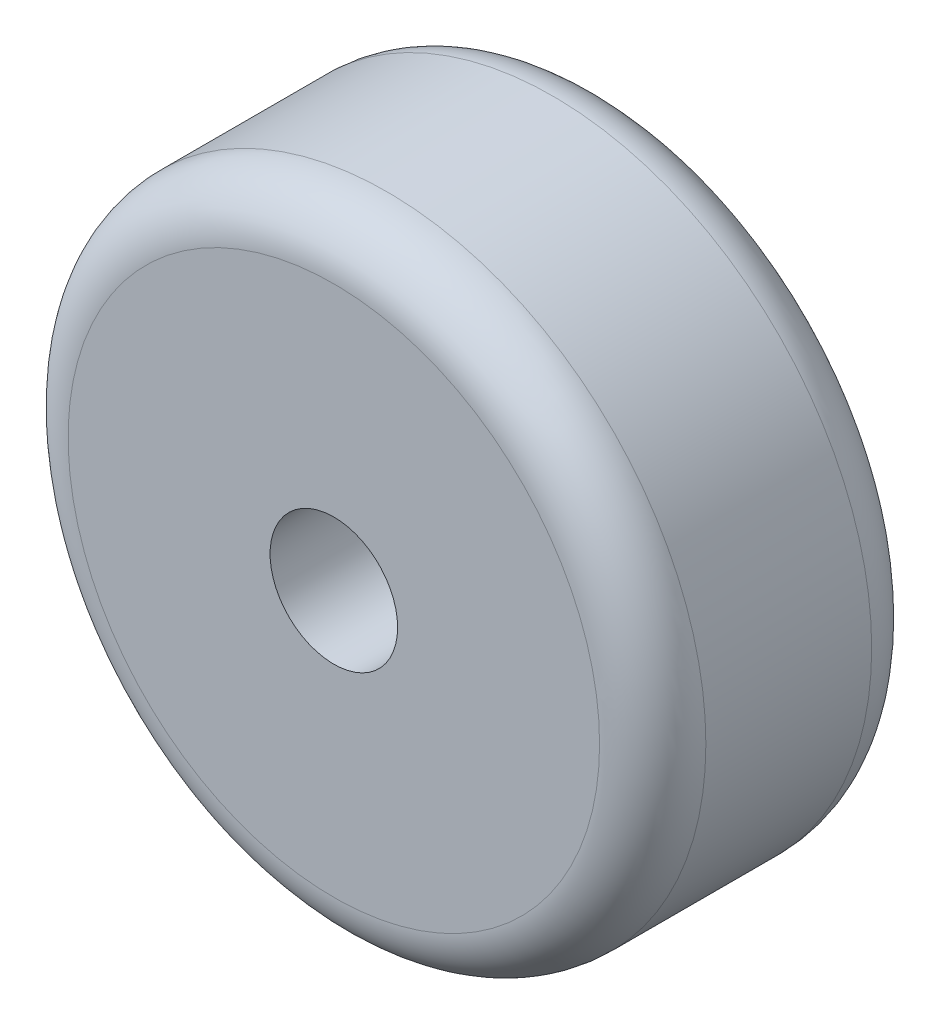
from build123d import *

# Parameters (mm, degrees)
SKETCH_1_R      = 30
SKETCH_1_R_2    = 6
EXTRUDE_1_DEPTH = 25.6
FILLET_2_R      = 5


with BuildPart() as part:
    # ｽｹｯﾁ1 → ﾎﾞｽ - 押し出し1 (new body)
    with BuildSketch(Plane.XY):
        Circle(SKETCH_1_R)
        Circle(SKETCH_1_R_2, mode=Mode.SUBTRACT)
    extrude(amount=EXTRUDE_1_DEPTH)

    # ﾌｨﾚｯﾄ2
    fillet_2_edges = [part.edges().sort_by_distance(p)[0] for p in [
        (-30, 0, 25.6),
        (-30, 0, 0),
    ]]
    fillet(fillet_2_edges, radius=FILLET_2_R)


solid = part.part
